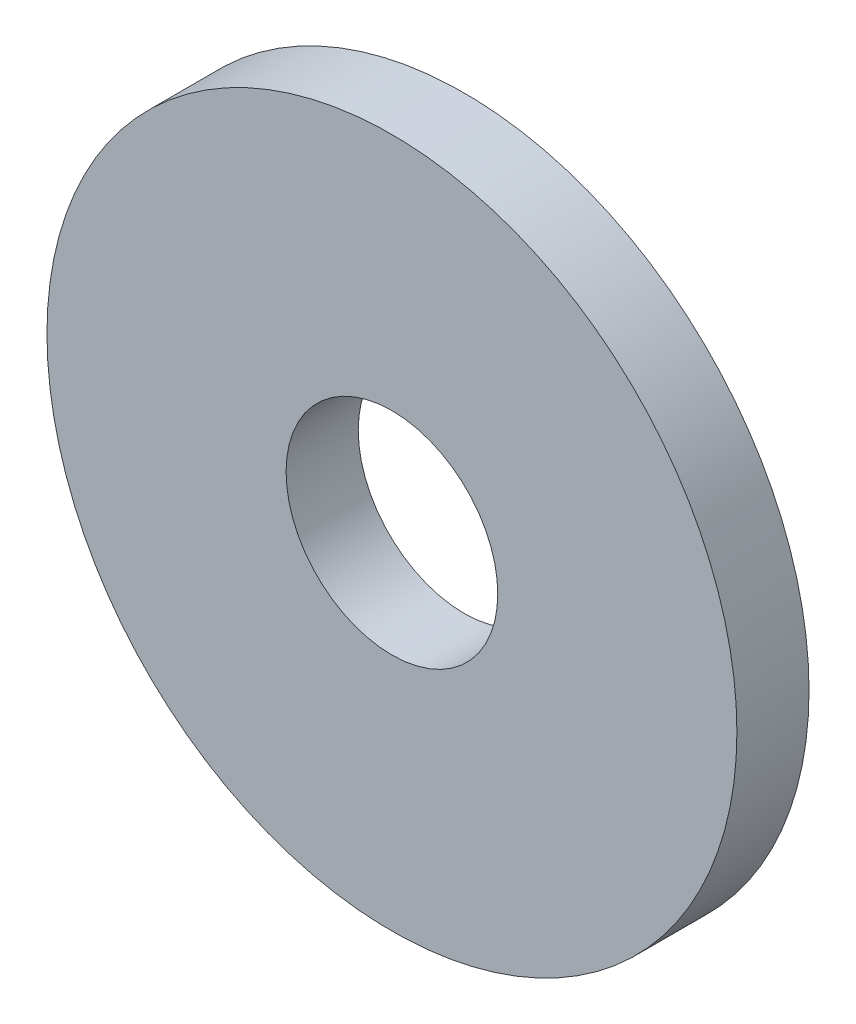
from build123d import *

# Parameters (mm, degrees)
SKETCH1_R           = 22
SKETCH1_R_2         = 6.75
BOSS_EXTRUDE1_DEPTH = 4.6


with BuildPart() as part:
    # Sketch1 → Boss-Extrude1 (new body)
    with BuildSketch(Plane.XY):
        Circle(SKETCH1_R)
        Circle(SKETCH1_R_2, mode=Mode.SUBTRACT)
    extrude(amount=BOSS_EXTRUDE1_DEPTH)


solid = part.part
